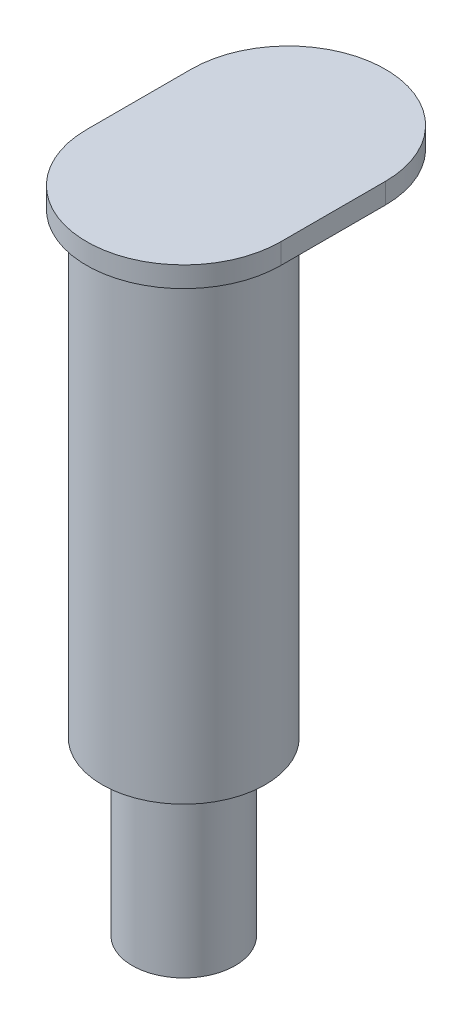
from build123d import *

# Parameters (mm, degrees)
SKETCH1_R           = 15.875
BOSS_EXTRUDE1_DEPTH = 88.9
BOSS_EXTRUDE2_DEPTH = 4
SKETCH3_R           = 9.999999939
BOSS_EXTRUDE3_DEPTH = 33.399999906


with BuildPart() as part:
    # Sketch1 → Boss-Extrude1 (new body)
    with BuildSketch(Plane(origin=(0, 0, 0), x_dir=(1, 0, 0), z_dir=(0, 1, 0))):
        Circle(SKETCH1_R)
    extrude(amount=BOSS_EXTRUDE1_DEPTH)

    # Sketch2 → Boss-Extrude2 (add)
    with BuildSketch(Plane(origin=(0, 88.9, 0), x_dir=(1, 0, 0), z_dir=(0, 1, 0))):
        with BuildLine():
            Line((-18.875, 0), (-18.875, 20.32))
            ThreePointArc((-18.875, 20.32), (0, 39.195), (18.875, 20.32))
            Line((18.875, 20.32), (18.875, 0))
            ThreePointArc((18.875, 0), (0, -18.875), (-18.875, 0))
        make_face()
    extrude(amount=BOSS_EXTRUDE2_DEPTH)

    # Sketch3 → Boss-Extrude3 (add)
    with BuildSketch(Plane.XZ):
        Circle(SKETCH3_R)
    extrude(amount=BOSS_EXTRUDE3_DEPTH)


solid = part.part
